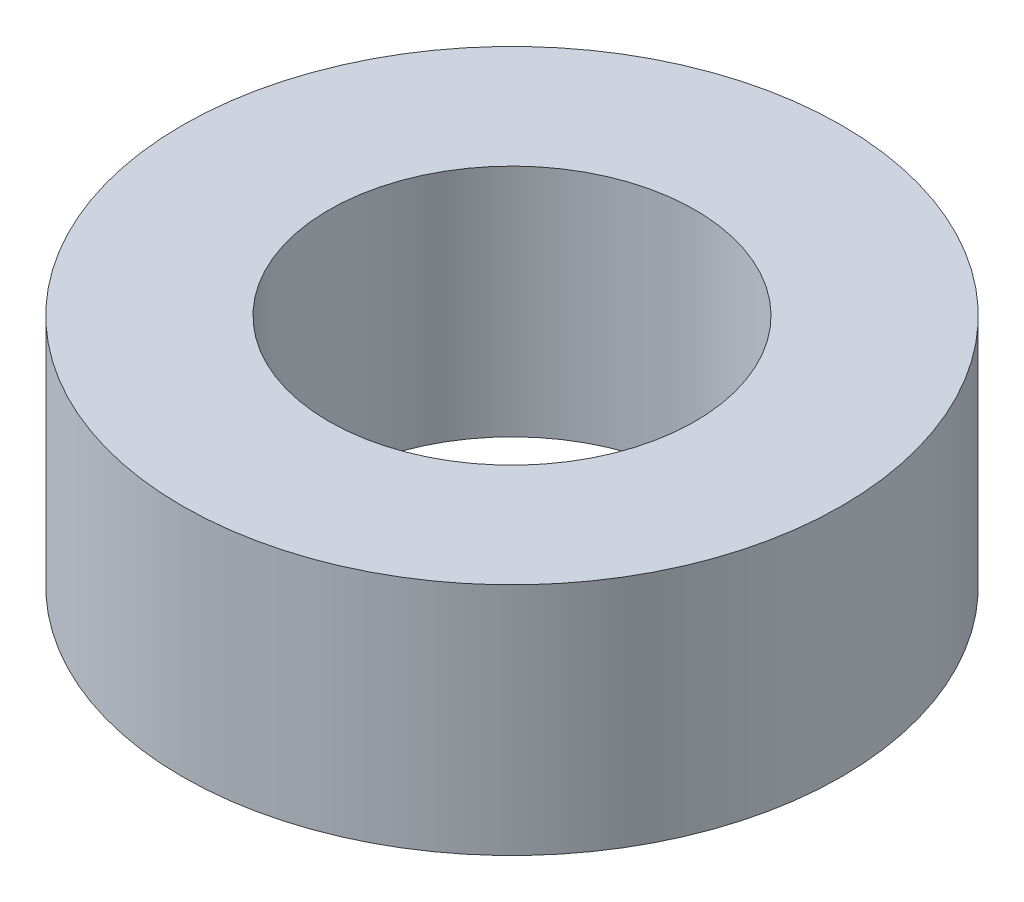
from build123d import *

# Parameters (mm, degrees)
SKETCH1_R           = 22.5
BOSS_EXTRUDE1_DEPTH = 16
SKETCH2_R           = 12.5
CUT_EXTRUDE1_DEPTH  = 36.616007637


with BuildPart() as part:
    # Sketch1 → Boss-Extrude1 (new body)
    with BuildSketch(Plane(origin=(0, 0, 0), x_dir=(1, 0, 0), z_dir=(0, 1, 0))):
        Circle(SKETCH1_R)
    extrude(amount=BOSS_EXTRUDE1_DEPTH)

    # Sketch2 → Cut-Extrude1 (cut, through all)
    with BuildSketch(Plane(origin=(0, 0, 0), x_dir=(1, 0, 0), z_dir=(0, 1, 0))):
        Circle(SKETCH2_R)
    extrude(amount=CUT_EXTRUDE1_DEPTH, mode=Mode.SUBTRACT)


solid = part.part
